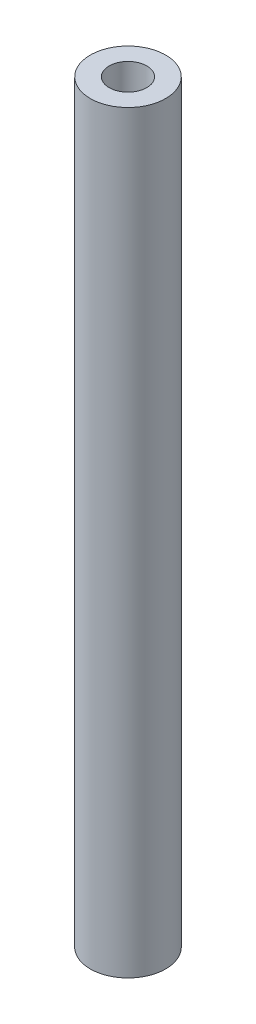
from build123d import *

# Parameters (mm, degrees)
SKETCH_1_R         = 2.5
EXTRUDE_1_DEPTH    = 50
HOLE_WIZARD_M3_1_D = 2.5


with BuildPart() as part:
    # 草图1 → 凸台-拉伸1 (new body)
    with BuildSketch(Plane(origin=(0, 0, 0), x_dir=(1, 0, 0), z_dir=(0, 1, 0))):
        Circle(SKETCH_1_R)
    extrude(amount=EXTRUDE_1_DEPTH)

    # M3 螺纹孔1 (through all)
    with Locations(Plane(origin=(0, 50, 0), x_dir=(1, 0, 0), z_dir=(0, 1, 0))):
        with Locations((0, 0)):
            Hole(HOLE_WIZARD_M3_1_D / 2)


solid = part.part
